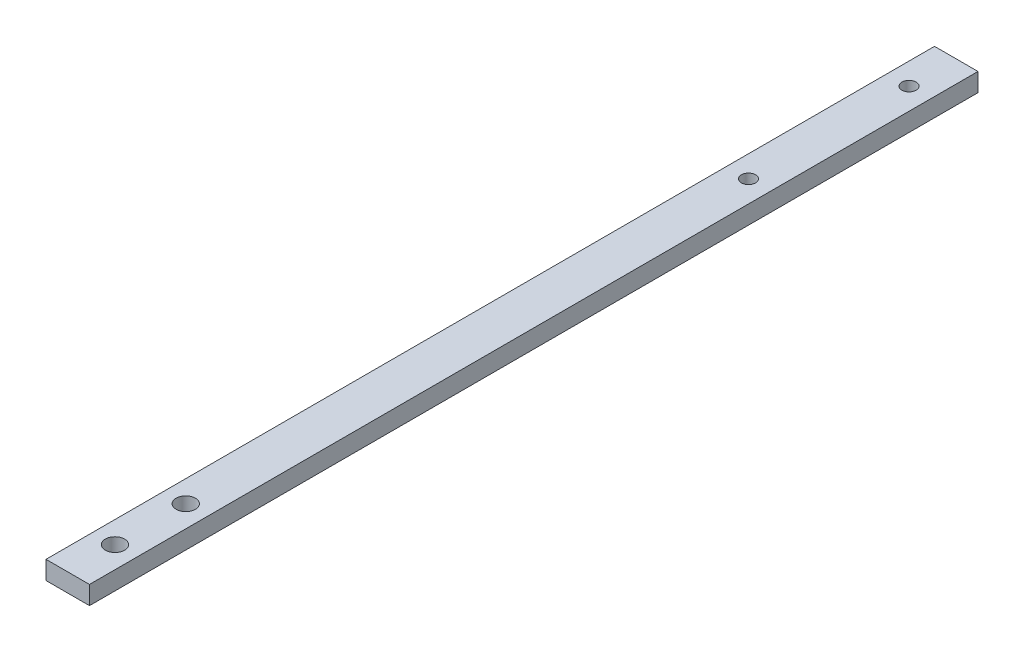
from build123d import *

# Parameters (mm, degrees)
SKETCH1_R               = 2.5
BOSS_EXTRUDE1_DEPTH     = 56
SKETCH2_W               = 4.604836256
SKETCH2_H               = 1.948199954
BOSS_EXTRUDE2_DEPTH     = 38.1
SKETCH3_R               = 1.022717979
CUT_EXTRUDE1_DEPTH      = 95.197289614
CUT_EXTRUDE2_DEPTH      = 95.16639528
CUT_EXTRUDE2_DEPTH_BACK = 95.16639528
SKETCH4_R               = 0.75
SKETCH5_OUTSIDE_W       = 25.874
SKETCH5_OUTSIDE_H       = 25.874
SKETCH5_OUTSIDE_W_2     = 4.604836256
SKETCH5_OUTSIDE_H_2     = 1.948199954
CUT_EXTRUDE3_DEPTH      = 95.166395385


with BuildPart() as part:
    # Sketch1 → Boss-Extrude1 (new body)
    with BuildSketch(Plane.XY):
        Circle(SKETCH1_R)
    extrude(amount=BOSS_EXTRUDE1_DEPTH)

    # Sketch2 → Boss-Extrude2 (add)
    with BuildSketch(Plane.XY.offset(56)):
        Rectangle(SKETCH2_W, SKETCH2_H)
    extrude(amount=BOSS_EXTRUDE2_DEPTH)

    # Sketch3 → Cut-Extrude1 (cut, through all)
    with BuildSketch(Plane(origin=(0, 0.974099977, 0), x_dir=(1, 0, 0), z_dir=(0, 1, 0))):
        with Locations((0, -81.6)):
            Circle(SKETCH3_R)
        with Locations((0, -89.1)):
            Circle(SKETCH3_R)
    extrude(amount=-CUT_EXTRUDE1_DEPTH, mode=Mode.SUBTRACT)

    # Sketch4 → Cut-Extrude2 (cut, two sides: drawn at the far end of the back side and taken through both)
    with BuildSketch(Plane(origin=(0, 0, 0), x_dir=(1, 0, 0), z_dir=(0, 1, 0)).offset(-CUT_EXTRUDE2_DEPTH_BACK)):
        with Locations((0, -5)):
            Circle(SKETCH4_R)
        with Locations((0, -22)):
            Circle(SKETCH4_R)
    extrude(amount=CUT_EXTRUDE2_DEPTH + CUT_EXTRUDE2_DEPTH_BACK, mode=Mode.SUBTRACT)

    # Sketch5 outside → Cut-Extrude3 (cut, through all)
    with BuildSketch(Plane.XY.offset(94.1)):
        Rectangle(SKETCH5_OUTSIDE_W, SKETCH5_OUTSIDE_H)
        Rectangle(SKETCH5_OUTSIDE_W_2, SKETCH5_OUTSIDE_H_2, mode=Mode.SUBTRACT)
    extrude(amount=-CUT_EXTRUDE3_DEPTH, mode=Mode.SUBTRACT)


solid = part.part
